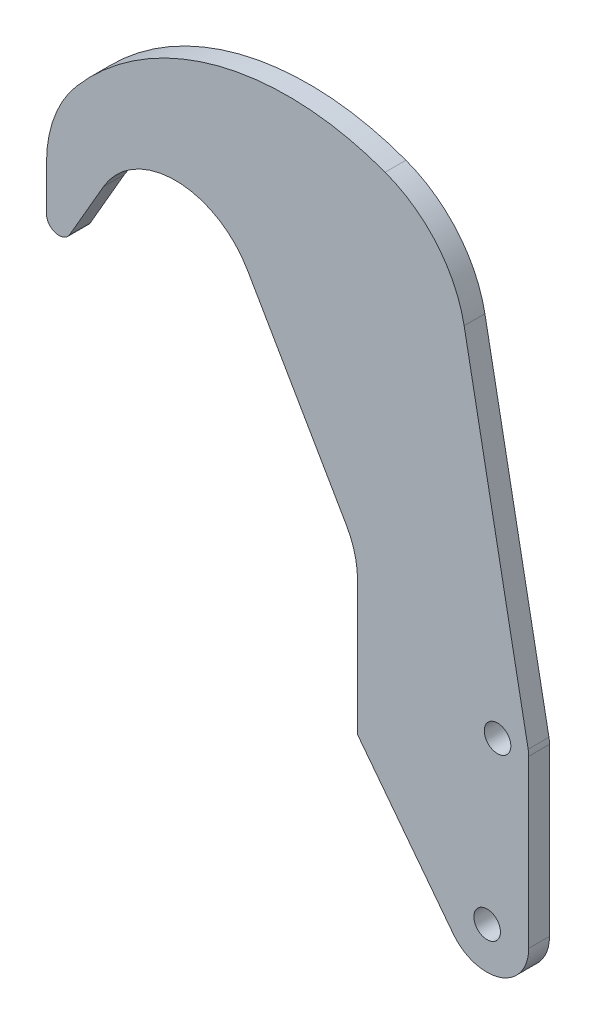
from build123d import *

# Parameters (mm, degrees)
SKETCH1_R           = 2.032
BOSS_EXTRUDE1_DEPTH = 1.5875
FILLET1_R           = 19.05


with BuildPart() as part:
    # Sketch1 → Boss-Extrude1 (new, symmetric)
    with BuildSketch(Plane.XY):
        with BuildLine():
            Line((10.998522628, 23.8125), (26.121491242, -2.38125))
            ThreePointArc((26.121491242, -2.38125), (27.390226607, -5.444248127), (27.822968614, -8.73125))
            Line((27.822968614, -8.73125), (27.822968614, -29.239270948))
            Line((27.822968614, -29.239270948), (42.458005799, -48.315226419))
            ThreePointArc((42.458005799, -48.315226419), (44.687348893, -50.145027996), (47.496113055, -50.8))
            Line((47.496113055, -50.8), (47.625, -50.8))
            ThreePointArc((47.625, -50.8), (52.115128061, -48.940128061), (53.975, -44.45))
            Line((53.975, -44.45), (53.975, -19.05))
            ThreePointArc((53.975, -19.05), (53.953759138, -18.600702728), (53.890226021, -18.155413209))
            Line((53.890226021, -18.155413209), (42.458005799, 41.622793369))
            ThreePointArc((42.458005799, 41.622793369), (8.463163904, 49.01990761), (-19.685944915, 28.575))
            Line((-19.685944915, 28.575), (-19.685944915, 15.875))
            ThreePointArc((-19.685944915, 15.875), (-18.273995196, 14.034911301), (-16.131166521, 14.9225))
            Line((-16.131166521, 14.9225), (-10.998522628, 23.8125))
            ThreePointArc((-10.998522628, 23.8125), (0, 30.1625), (10.998522628, 23.8125))
        make_face()
        with Locations((47.625, -44.45)):
            Circle(SKETCH1_R, mode=Mode.SUBTRACT)
        with Locations((49.2125, -19.05)):
            Circle(SKETCH1_R, mode=Mode.SUBTRACT)
    extrude(amount=BOSS_EXTRUDE1_DEPTH, both=True)

    # Fillet1
    fillet1_edges = [part.edges().sort_by_distance(p)[0] for p in [
        (-19.685944915, 28.575, 0),
        (42.458005799, 41.622793369, 0),
    ]]
    fillet(fillet1_edges, radius=FILLET1_R)


solid = part.part
